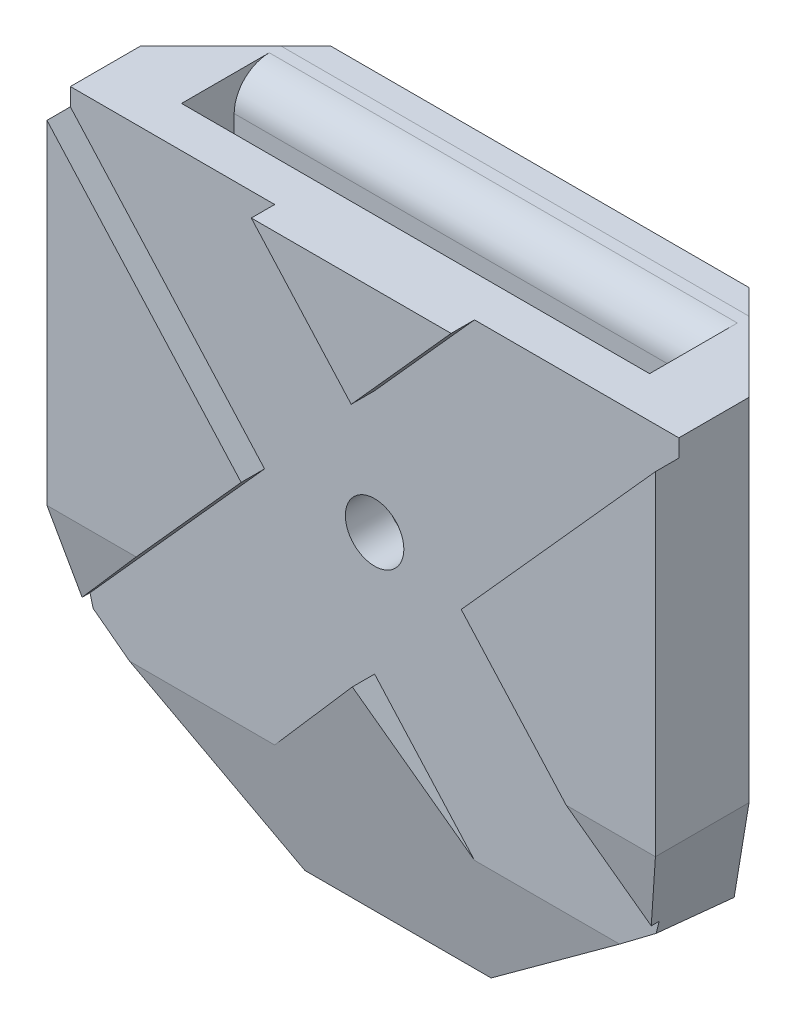
from build123d import *

# Parameters (mm, degrees)
EXTRUDE_1_DEPTH           = 15
EXTRUDE_1_OTHER_WAY_DEPTH = 10
EXTRUDE_1_OTHER_WAY_TAPER = 6
CUT_EXTRUDE_1_DEPTH       = 17
EXTRUDE_2_DEPTH           = 1
EXTRUDE_3_REACH           = 32.166
EXTRUDE_4_DEPTH           = 3
CUT_EXTRUDE_3_DEPTH       = 31.282007959
EXTRUDE_5_DEPTH           = 15
CHAMFER_2_SIZE            = 15
CHAMFER_2_SIZE_2          = 1.1
CUT_EXTRUDE_2_DEPTH       = 31.430248211
CUT_EXTRUDE_2_DEPTH_BACK  = 31.430248211
SKETCH_3_R                = 1.25
SKETCH_8_R                = 1.25
CUT_EXTRUDE_6_DEPTH       = 1
CUT_EXTRUDE_7_DEPTH       = 10
FILLET_1_R                = 1.5
SKETCH_13_W               = 20
SKETCH_13_H               = 0.25
CUT_EXTRUDE_8_DEPTH       = 17


with BuildPart() as part:
    # Эскиз1 → Бобышка-Вытянуть1 (new body)
    with BuildSketch(Plane(origin=(0, 0, 0), x_dir=(1, 0, 0), z_dir=(0, 1, 0))):
        Polygon((0, 0), (3, 0), (13, 0), (26, 0), (23, 3), (3, 3), align=None)
    extrude(amount=EXTRUDE_1_DEPTH)

    # Эскиз1 → Бобышка-Вытянуть1 other way (add)
    with BuildSketch(Plane(origin=(0, 0, 0), x_dir=(1, 0, 0), z_dir=(0, 1, 0))):
        Polygon((0, 0), (3, 0), (13, 0), (26, 0), (23, 3), (3, 3), align=None)
    extrude(amount=-EXTRUDE_1_OTHER_WAY_DEPTH, taper=EXTRUDE_1_OTHER_WAY_TAPER)

    # Эскиз2 → Вырез-Вытянуть1 (cut)
    with BuildSketch(Plane(origin=(0, 15, 0), x_dir=(1, 0, 0), z_dir=(0, 1, 0))):
        Polygon((13, 0), (23, 0), (23, 1), (3, 1), (3, 0), align=None)
    extrude(amount=-CUT_EXTRUDE_1_DEPTH, mode=Mode.SUBTRACT)

    # Эскиз4 → Бобышка-Вытянуть2 (add)
    with BuildSketch(Plane.XY):
        Polygon((0, 15), (3, 15), (3, -2), (23, -2), (23, 15), (26, 15), (26, 0), (23.462559298, -10), (2.537440702, -10), (0, 0), align=None)
    extrude(amount=EXTRUDE_2_DEPTH)

    # Эскиз5 → Бобышка-Вытянуть3 (add, up to next)
    with BuildSketch(Plane(origin=(0, 0, 0), x_dir=(-1, 0, 0), z_dir=(0, 0, -1)), mode=Mode.PRIVATE) as extrude_3_sk1:
        Polygon((-26, 0), (-23.462559298, -10), (-2.537440702, -10), (0, 0), (-3, 0), (-3, -2), (-23, -2), (-23, 0), align=None)
    extrude_3_tool1 = extrude(extrude_3_sk1.sketch, amount=EXTRUDE_3_REACH, mode=Mode.PRIVATE) - part.part
    add(extrude_3_tool1.solids().sort_by_distance((13, -5.604799, 0))[0])

    # Эскиз6 → Бобышка-Вытянуть4 (add)
    with BuildSketch(Plane.XY.offset(1)):
        Polygon((0, 15), (26, 15), (26, 0), (23.462559298, -10), (2.537440702, -10), (0, 0), align=None)
    extrude(amount=EXTRUDE_4_DEPTH)

    # Эскиз7 → Вырез-Вытянуть3 (cut, through all)
    with BuildSketch(Plane(origin=(26, 0, 0), x_dir=(0, 0, -1), z_dir=(1, 0, 0))):
        Polygon((-4, 0), (-2, -10), (-4, -10), align=None)
    extrude(amount=-CUT_EXTRUDE_3_DEPTH, mode=Mode.SUBTRACT)

    # Эскиз3 → Вырез-Вытянуть2 (cut, two sides: drawn at the far end of the back side and taken through both)
    with BuildSketch(Plane.XY.offset(-1).offset(-CUT_EXTRUDE_2_DEPTH_BACK)):
        with Locations((13, 5)):
            Circle(SKETCH_3_R)
    extrude(amount=CUT_EXTRUDE_2_DEPTH + CUT_EXTRUDE_2_DEPTH_BACK, mode=Mode.SUBTRACT)

    # Эскиз8 → Вырез-Вытянуть6 (cut)
    # profile 1 of 9: a face of its own
    with BuildSketch(Plane.XY.offset(4)):
        Polygon((0, 15), (8.73082864, 15), (1.328128151, 23.251624877), (-3.882385082, 18.577167491), (0, 14.249559563), align=None)
    # profile 2 of 9: a face of its own
    with BuildSketch(Plane.XY.offset(4)):
        Polygon((8.297967991, 5), (13, 10.241250048), (8.73082864, 15), (0, 15), (0, 14.249559563), (2.253001305, 11.738189335), align=None)
    # profile 3 of 9: a face of its own
    with BuildSketch(Plane.XY.offset(4)):
        Polygon((13.216430324, 0), (15.605256616, 2.662771307), (17.702032009, 5), (13, 10.241250048), (8.297967991, 5), (12.783569676, 0), align=None)
        with Locations((13, 5)):
            Circle(SKETCH_8_R, mode=Mode.SUBTRACT)
    # profile 4 of 9: a face of its own
    with BuildSketch(Plane.XY.offset(4)):
        Polygon((13, 10.241250048), (17.702032009, 5), (26, 14.249559563), (26, 15), (17.26917136, 15), align=None)
    # profile 5 of 9: a face of its own
    with BuildSketch(Plane.XY.offset(4)):
        Polygon((22.187633693, 0), (13.216430324, 0), (13, -0.241250048), (22.828799983, -11.197193837), (28.039313215, -6.522736451), align=None)
    # profile 6 of 9: a face of its own
    with BuildSketch(Plane.XY.offset(4)):
        Polygon((17.702032009, 5), (15.605256616, 2.662771307), (13.216430324, 0), (22.187633693, 0), align=None)
    # profile 7 of 9: a face of its own
    with BuildSketch(Plane.XY.offset(4)):
        Polygon((4.245226956, -10), (13, -0.241250048), (12.783569676, 0), (3.812366307, 0), (-0.965286277, -5.325542614), align=None)
    # profile 8 of 9: a face of its own
    with BuildSketch(Plane.XY.offset(4)):
        Polygon((3.812366307, 0), (12.783569676, 0), (8.297967991, 5), align=None)
    # profile 9 of 9: a face of its own
    with BuildSketch(Plane.XY.offset(4)):
        Polygon((13, -0.241250048), (13.216430324, 0), (12.783569676, 0), align=None)
    extrude(amount=-CUT_EXTRUDE_6_DEPTH, mode=Mode.SUBTRACT)

    # Эскиз9 → Вырез-Вытянуть7 (cut)
    with BuildSketch(Plane(origin=(0, -0.311867536, -2.967221401), x_dir=(-1, 0, 0), z_dir=(0, -0.1045284632676535, -0.9945218953682734))):
        Polygon((-26.132775008, -3.289566809), (-16.54562193, -10.479237314), (-26.132775008, -10.479237314), align=None)
        Polygon((0.132775008, -10.479237314), (0.132775008, -3.289566809), (-9.45437807, -10.479237314), align=None)
    extrude(amount=-CUT_EXTRUDE_7_DEPTH, mode=Mode.SUBTRACT)

    # Скругление1
    fillet_1_edges = [part.edges().sort_by_distance(p)[0] for p in [
        (13, 15, -1),
    ]]
    fillet(fillet_1_edges, radius=FILLET_1_R)

    # Эскиз13 → Вырез-Вытянуть8 (cut)
    with BuildSketch(Plane(origin=(0, 15, 0), x_dir=(1, 0, 0), z_dir=(0, 1, 0))):
        with Locations((13, -1.125)):
            Rectangle(SKETCH_13_W, SKETCH_13_H)
    extrude(amount=-CUT_EXTRUDE_8_DEPTH, mode=Mode.SUBTRACT)


with BuildPart() as body_2:
    # Эскиз11 → Бобышка-Вытянуть5 (new body)
    with BuildSketch(Plane(origin=(0, 15, 0), x_dir=(1, 0, 0), z_dir=(0, 1, 0))):
        Polygon((3, 3), (4.060660172, 4.060660172), (21.939339828, 4.060660172), (23, 3), align=None)
    extrude(amount=-EXTRUDE_5_DEPTH)

    # Фаска2
    # the kernel refuses this chamfer: 15, 1.1 mm, written as the material it takes off along each edge
    with BuildSketch(Plane(origin=(-34.935477004, 0, -4.060660172), x_dir=(0, 0.9999960428385148, -0.0028132378696003233), z_dir=(1, 0, 0))) as chamfer_2_piece_1:
        Polygon((CHAMFER_2_SIZE * 0.999996042839, CHAMFER_2_SIZE * 0.0028132378696), (-CHAMFER_2_SIZE_2 * 0.0028132378696, CHAMFER_2_SIZE_2 * 0.999996042839), (0, 0), align=None)
    extrude(amount=95.870954008, mode=Mode.SUBTRACT)


solid = Compound([part.part, body_2.part])
